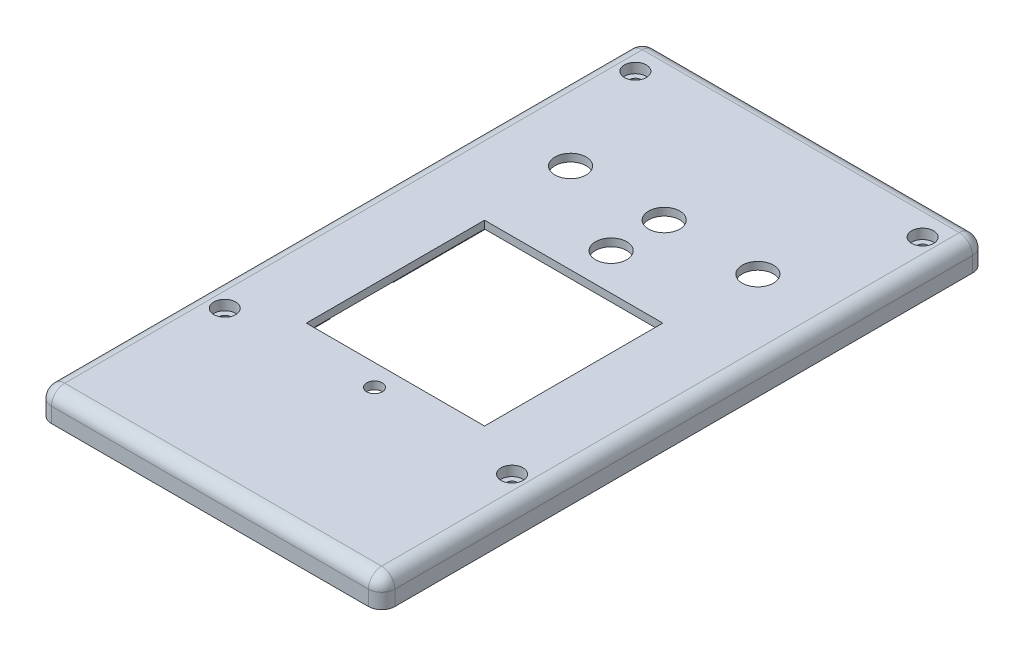
from build123d import *

# Parameters (mm, degrees)
SKETCH1_W                                      = 55.88
SKETCH1_H                                      = 98.298
BOSS_EXTRUDE1_DEPTH                            = 3.81
FILLET1_R                                      = 2.159
CUT_EXTRUDE4_DEPTH                             = 0.7874
CUT_EXTRUDE5_DEPTH                             = 1.778
FILLET4_R                                      = 1.016
CBORE_FOR_0_BUTTON_HEAD_CAP_SCREW1_D           = 1.778
CBORE_FOR_0_BUTTON_HEAD_CAP_SCREW1_CBORE_D     = 3.57124
CBORE_FOR_0_BUTTON_HEAD_CAP_SCREW1_CBORE_DEPTH = 1.6127984
SKETCH15_R                                     = 2.54
CUT_EXTRUDE6_DEPTH                             = 57.924913502
SKETCH16_W                                     = 29
SKETCH16_H                                     = 29
CUT_EXTRUDE7_DEPTH                             = 57.994566408
BOSS_EXTRUDE2_DEPTH                            = 0.8
SKETCH18_R                                     = 1.27
CUT_EXTRUDE8_DEPTH                             = 58.053629157


with BuildPart() as part:
    # Sketch1 → Boss-Extrude1 (new body)
    with BuildSketch(Plane(origin=(0, 0, 0), x_dir=(1, 0, 0), z_dir=(0, 1, 0))):
        with Locations((0, -0.381)):
            Rectangle(SKETCH1_W, SKETCH1_H)
    extrude(amount=BOSS_EXTRUDE1_DEPTH)

    # Fillet1
    fillet1_edges = [part.edges().sort_by_distance(p)[0] for p in [
        (0, 3.81, 49.53),
        (27.94, 3.81, 0.381),
        (0, 3.81, -48.768),
        (-27.94, 3.81, 0.381),
        (-27.94, 1.905, -48.768),
        (27.94, 1.905, -48.768),
        (27.94, 1.905, 49.53),
        (-27.94, 1.905, 49.53),
    ]]
    fillet(fillet1_edges, radius=FILLET1_R)

    # Sketch7 → Cut-Extrude4 (cut)
    with BuildSketch(Plane.XZ):
        with BuildLine():
            Line((-25.781, -47.752), (25.781, -47.752))
            ThreePointArc((25.781, -47.752), (26.589223051, -47.417223051), (26.924, -46.609))
            Line((26.924, -46.609), (26.924, 47.371))
            ThreePointArc((26.924, 47.371), (26.589223051, 48.179223051), (25.781, 48.514))
            Line((25.781, 48.514), (-25.781, 48.514))
            ThreePointArc((-25.781, 48.514), (-26.589223051, 48.179223051), (-26.924, 47.371))
            Line((-26.924, 47.371), (-26.924, -46.609))
            ThreePointArc((-26.924, -46.609), (-26.589223051, -47.417223051), (-25.781, -47.752))
        make_face()
    extrude(amount=-CUT_EXTRUDE4_DEPTH, mode=Mode.SUBTRACT)

    # Sketch12 → Cut-Extrude5 (cut)
    with BuildSketch(Plane.XZ.offset(-0.7874)):
        with BuildLine():
            Line((19.812, -38.1), (26.924, -38.1))
            Line((26.924, -38.1), (26.924, -17.145))
            Line((26.924, -17.145), (19.812, -17.145))
            Line((19.812, -17.145), (19.812, -11.275000024))
            Line((19.812, -11.275000024), (22.346000012, -11.275000024))
            Line((22.346000012, -11.275000024), (22.346000012, -3.275))
            Line((22.346000012, -3.275), (26.924, -3.275))
            Line((26.924, -3.275), (26.924, 12.725))
            Line((26.924, 12.725), (22.346000012, 12.725))
            Line((22.346000012, 12.725), (22.346000012, 20.725))
            Line((22.346000012, 20.725), (19.812, 20.725))
            Line((19.812, 20.725), (19.812, 27.94))
            Line((19.812, 27.94), (26.924, 27.94))
            Line((26.924, 27.94), (26.924, 47.371))
            ThreePointArc((26.924, 47.371), (26.589223051, 48.179223051), (25.781, 48.514))
            Line((25.781, 48.514), (8.5725, 48.514))
            Line((8.5725, 48.514), (8.5725, 44.704))
            Line((8.5725, 44.704), (-8.5725, 44.704))
            Line((-8.5725, 44.704), (-8.5725, 48.514))
            Line((-8.5725, 48.514), (-25.781, 48.514))
            ThreePointArc((-25.781, 48.514), (-26.589223051, 48.179223051), (-26.924, 47.371))
            Line((-26.924, 47.371), (-26.924, 27.94))
            Line((-26.924, 27.94), (-16.28, 27.94))
            Line((-16.28, 27.94), (-16.28, 13.727444148))
            Line((-16.28, 13.727444148), (-26.924, 13.727444148))
            Line((-26.924, 13.727444148), (-26.924, 3.429))
            Line((-26.924, 3.429), (-16.28, 3.429))
            Line((-16.28, 3.429), (-16.28, -17.145))
            Line((-16.28, -17.145), (-26.924, -17.145))
            Line((-26.924, -17.145), (-26.924, -38.1))
            Line((-26.924, -38.1), (-19.812, -38.1))
            Line((-19.812, -38.1), (-19.812, -47.752))
            Line((-19.812, -47.752), (19.812, -47.752))
            Line((19.812, -47.752), (19.812, -38.1))
        make_face()
    extrude(amount=-CUT_EXTRUDE5_DEPTH, mode=Mode.SUBTRACT)

    # Fillet4
    fillet4_edges = [part.edges().sort_by_distance(p)[0] for p in [
        (26.924, 2.5654, 37.6555),
        (26.589223051, 2.5654, 48.179223051),
        (-26.924, 2.5654, 37.6555),
        (-26.589223051, 2.5654, 48.179223051),
        (0, 2.5654, -47.752),
        (-26.924, 2.5654, 8.578222074),
        (-26.924, 2.5654, -27.6225),
        (26.924, 2.5654, -27.6225),
        (26.924, 2.5654, 4.725),
        (17.17675, 2.5654, 48.514),
        (-17.17675, 2.5654, 48.514),
    ]]
    fillet(fillet4_edges, radius=FILLET4_R)

    # CBORE for #0 Button Head Cap Screw1 (through all)
    with Locations(Plane(origin=(0, 3.81, 0), x_dir=(1, 0, 0), z_dir=(0, 1, 0))):
        with Locations((-23.3172, -23.79600016), (23.4188, -23.79600016), (23.4188, 43.00599984), (-23.3172, 43.00599984)):
            CounterBoreHole(CBORE_FOR_0_BUTTON_HEAD_CAP_SCREW1_D / 2, CBORE_FOR_0_BUTTON_HEAD_CAP_SCREW1_CBORE_D / 2, CBORE_FOR_0_BUTTON_HEAD_CAP_SCREW1_CBORE_DEPTH)

    # Sketch15 → Cut-Extrude6 (cut, through all)
    with BuildSketch(Plane.XZ.offset(-2.5654)):
        with Locations((0, -24.384)):
            Circle(SKETCH15_R)
        with Locations((-15.24, -24.384)):
            Circle(SKETCH15_R)
        with Locations((15.24, -24.384)):
            Circle(SKETCH15_R)
        with Locations((0, -15.748)):
            Circle(SKETCH15_R)
    extrude(amount=-CUT_EXTRUDE6_DEPTH, mode=Mode.SUBTRACT)

    # Sketch16 → Cut-Extrude7 (cut, through all)
    with BuildSketch(Plane(origin=(0, 3.81, 0), x_dir=(1, 0, 0), z_dir=(0, 1, 0))):
        with Locations((-0.096217614, -4.75092588)):
            Rectangle(SKETCH16_W, SKETCH16_H)
    extrude(amount=-CUT_EXTRUDE7_DEPTH, mode=Mode.SUBTRACT)

    # Sketch17 → Boss-Extrude2 (add)
    with BuildSketch(Plane.XZ):
        with BuildLine():
            Line((-27.94, 47.371), (-27.94, -46.609))
            ThreePointArc((-27.94, -46.609), (-27.307643541, -48.135643541), (-25.781, -48.768))
            Line((-25.781, -48.768), (25.781, -48.768))
            ThreePointArc((25.781, -48.768), (27.307643541, -48.135643541), (27.94, -46.609))
            Line((27.94, -46.609), (27.94, 47.371))
            ThreePointArc((27.94, 47.371), (27.307643541, 48.897643541), (25.781, 49.53))
            Line((25.781, 49.53), (-25.781, 49.53))
            ThreePointArc((-25.781, 49.53), (-27.307643541, 48.897643541), (-27.94, 47.371))
        make_face()
        with BuildLine():
            Line((-25.781, -47.752), (25.781, -47.752))
            ThreePointArc((25.781, -47.752), (26.589223051, -47.417223051), (26.924, -46.609))
            Line((26.924, -46.609), (26.924, 47.371))
            ThreePointArc((26.924, 47.371), (26.589223051, 48.179223051), (25.781, 48.514))
            Line((25.781, 48.514), (-25.781, 48.514))
            ThreePointArc((-25.781, 48.514), (-26.589223051, 48.179223051), (-26.924, 47.371))
            Line((-26.924, 47.371), (-26.924, -46.609))
            ThreePointArc((-26.924, -46.609), (-26.589223051, -47.417223051), (-25.781, -47.752))
        make_face(mode=Mode.SUBTRACT)
    extrude(amount=BOSS_EXTRUDE2_DEPTH)

    # Sketch18 → Cut-Extrude8 (cut, through all)
    with BuildSketch(Plane(origin=(0, 3.81, 0), x_dir=(1, 0, 0), z_dir=(0, 1, 0))):
        with Locations((0, -22.752)):
            Circle(SKETCH18_R)
    extrude(amount=-CUT_EXTRUDE8_DEPTH, mode=Mode.SUBTRACT)


solid = part.part
